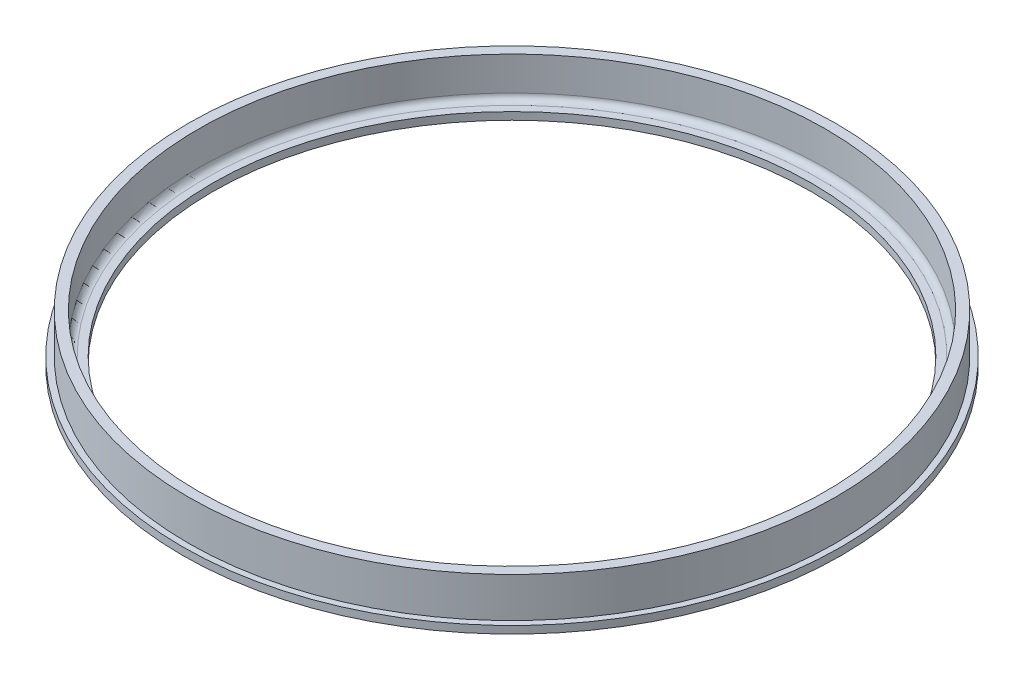
from build123d import *

# Parameters (mm, degrees)
CUT_EXTRUDE1_START = -10.16
SKETCH2_R          = 79.756
SKETCH2_R_2        = 76.2
CUT_EXTRUDE1_DEPTH = 10.16
FILLET1_R          = 1.5875


with BuildPart() as part:
    # Sketch1 → Revolve1 (revolve)
    with BuildSketch(Plane.XY):
        Polygon((-83.82, -19.330547638), (-83.82, -17.425547638), (-82.296, -17.425547638), (-82.296, -7.265547638), (-76.2, -7.265547638), (-76.2, -17.425547638), (-76.2, -19.330547638), align=None)
    revolve(axis=Axis((0, 0, 0), (0, 1, 0)))

    # Sketch2 → Cut-Extrude1 (cut)
    with BuildSketch(Plane(origin=(0, -7.265547638, 0), x_dir=(1, 0, 0), z_dir=(0, 1, 0)).offset(CUT_EXTRUDE1_START)):
        Circle(SKETCH2_R)
        Circle(SKETCH2_R_2, mode=Mode.SUBTRACT)
    extrude(amount=CUT_EXTRUDE1_DEPTH, mode=Mode.SUBTRACT)

    # Fillet1
    fillet1_edges = [part.edges().sort_by_distance(p)[0] for p in [
        (-79.756, -17.425547638, 0),
    ]]
    fillet(fillet1_edges, radius=FILLET1_R)


solid = part.part
